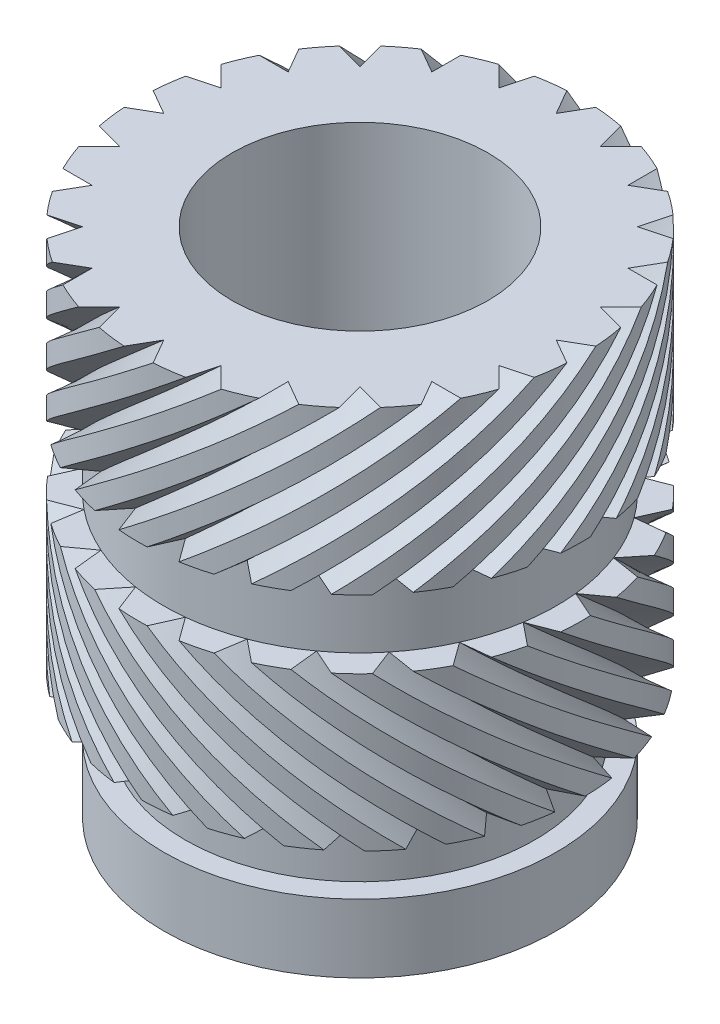
from build123d import *

# Parameters (mm, degrees)
CUT_SWEEP1_PITCH            = 12.666666667
CUT_SWEEP1_HEIGHT           = 1.9
CUT_SWEEP1_RADIUS           = 2.3
CUT_SWEEP1_START_ANGLE      = 180
CIRPATTERN1_COUNT           = 24
MIRROR1_COPY_1_PITCH        = 12.666666667
MIRROR1_COPY_1_HEIGHT       = 1.9
MIRROR1_COPY_1_RADIUS       = 2.3
MIRROR1_COPY_1_START_ANGLE  = -15
MIRROR1_COPY_2_PITCH        = 12.666666667
MIRROR1_COPY_2_HEIGHT       = 1.9
MIRROR1_COPY_2_RADIUS       = 2.3
MIRROR1_COPY_2_START_ANGLE  = -30
MIRROR1_COPY_3_PITCH        = 12.666666667
MIRROR1_COPY_3_HEIGHT       = 1.9
MIRROR1_COPY_3_RADIUS       = 2.3
MIRROR1_COPY_3_START_ANGLE  = -45
MIRROR1_COPY_4_PITCH        = 12.666666667
MIRROR1_COPY_4_HEIGHT       = 1.9
MIRROR1_COPY_4_RADIUS       = 2.3
MIRROR1_COPY_4_START_ANGLE  = -60
MIRROR1_COPY_5_PITCH        = 12.666666667
MIRROR1_COPY_5_HEIGHT       = 1.9
MIRROR1_COPY_5_RADIUS       = 2.3
MIRROR1_COPY_5_START_ANGLE  = -75
MIRROR1_COPY_6_PITCH        = 12.666666667
MIRROR1_COPY_6_HEIGHT       = 1.9
MIRROR1_COPY_6_RADIUS       = 2.3
MIRROR1_COPY_6_START_ANGLE  = -90
MIRROR1_COPY_7_PITCH        = 12.666666667
MIRROR1_COPY_7_HEIGHT       = 1.9
MIRROR1_COPY_7_RADIUS       = 2.3
MIRROR1_COPY_7_START_ANGLE  = -105
MIRROR1_COPY_8_PITCH        = 12.666666667
MIRROR1_COPY_8_HEIGHT       = 1.9
MIRROR1_COPY_8_RADIUS       = 2.3
MIRROR1_COPY_8_START_ANGLE  = -120
MIRROR1_COPY_9_PITCH        = 12.666666667
MIRROR1_COPY_9_HEIGHT       = 1.9
MIRROR1_COPY_9_RADIUS       = 2.3
MIRROR1_COPY_9_START_ANGLE  = -135
MIRROR1_COPY_10_PITCH       = 12.666666667
MIRROR1_COPY_10_HEIGHT      = 1.9
MIRROR1_COPY_10_RADIUS      = 2.3
MIRROR1_COPY_10_START_ANGLE = -150
MIRROR1_COPY_11_PITCH       = 12.666666667
MIRROR1_COPY_11_HEIGHT      = 1.9
MIRROR1_COPY_11_RADIUS      = 2.3
MIRROR1_COPY_11_START_ANGLE = -165
MIRROR1_COPY_12_PITCH       = 12.666666667
MIRROR1_COPY_12_HEIGHT      = 1.9
MIRROR1_COPY_12_RADIUS      = 2.3
MIRROR1_COPY_12_START_ANGLE = -180
MIRROR1_COPY_13_PITCH       = 12.666666667
MIRROR1_COPY_13_HEIGHT      = 1.9
MIRROR1_COPY_13_RADIUS      = 2.3
MIRROR1_COPY_13_START_ANGLE = 165
MIRROR1_COPY_14_PITCH       = 12.666666667
MIRROR1_COPY_14_HEIGHT      = 1.9
MIRROR1_COPY_14_RADIUS      = 2.3
MIRROR1_COPY_14_START_ANGLE = 150
MIRROR1_COPY_15_PITCH       = 12.666666667
MIRROR1_COPY_15_HEIGHT      = 1.9
MIRROR1_COPY_15_RADIUS      = 2.3
MIRROR1_COPY_15_START_ANGLE = 135
MIRROR1_COPY_16_PITCH       = 12.666666667
MIRROR1_COPY_16_HEIGHT      = 1.9
MIRROR1_COPY_16_RADIUS      = 2.3
MIRROR1_COPY_16_START_ANGLE = 120
MIRROR1_COPY_17_PITCH       = 12.666666667
MIRROR1_COPY_17_HEIGHT      = 1.9
MIRROR1_COPY_17_RADIUS      = 2.3
MIRROR1_COPY_17_START_ANGLE = 105
MIRROR1_COPY_18_PITCH       = 12.666666667
MIRROR1_COPY_18_HEIGHT      = 1.9
MIRROR1_COPY_18_RADIUS      = 2.3
MIRROR1_COPY_18_START_ANGLE = 90
MIRROR1_COPY_19_PITCH       = 12.666666667
MIRROR1_COPY_19_HEIGHT      = 1.9
MIRROR1_COPY_19_RADIUS      = 2.3
MIRROR1_COPY_19_START_ANGLE = 75
MIRROR1_COPY_20_PITCH       = 12.666666667
MIRROR1_COPY_20_HEIGHT      = 1.9
MIRROR1_COPY_20_RADIUS      = 2.3
MIRROR1_COPY_20_START_ANGLE = 60
MIRROR1_COPY_21_PITCH       = 12.666666667
MIRROR1_COPY_21_HEIGHT      = 1.9
MIRROR1_COPY_21_RADIUS      = 2.3
MIRROR1_COPY_21_START_ANGLE = 45
MIRROR1_COPY_22_PITCH       = 12.666666667
MIRROR1_COPY_22_HEIGHT      = 1.9
MIRROR1_COPY_22_RADIUS      = 2.3
MIRROR1_COPY_22_START_ANGLE = 30
MIRROR1_COPY_23_PITCH       = 12.666666667
MIRROR1_COPY_23_HEIGHT      = 1.9
MIRROR1_COPY_23_RADIUS      = 2.3
MIRROR1_COPY_23_START_ANGLE = 15
MIRROR1_COPY_24_PITCH       = 12.666666667
MIRROR1_COPY_24_HEIGHT      = 1.9
MIRROR1_COPY_24_RADIUS      = 2.3


with BuildPart() as part:
    # Sketch1 → Revolve1 (revolve)
    with BuildSketch(Plane.XY):
        Polygon((1.5, 6), (1.5, 0), (2.3, 0), (2.3, 0.8), (2.05, 0.8), (2.05, 1.5), (2.6, 1.5), (2.6, 3.3), (2.3, 3.3), (2.3, 4.1), (2.6, 4.1), (2.6, 6), align=None)
    revolve(axis=Axis((0, 0, 0), (0, 1, 0)))

    # Cut-Sweep1: sweep along a helix
    with BuildLine() as cut_sweep1_path:
        add(Helix(CUT_SWEEP1_PITCH, CUT_SWEEP1_HEIGHT, CUT_SWEEP1_RADIUS, center=(0, 6, 0), direction=(0, -1, 0), mode=Mode.PRIVATE).rotate(Axis((0, 6, 0), (0, -1, 0)), CUT_SWEEP1_START_ANGLE))
    # Sketch3 → Cut-Sweep1 (sweep, cut)
    with BuildSketch(Plane(origin=(0, 6, 0), x_dir=(1, 0, 0), z_dir=(0, 1, 0))):
        Polygon((-2.819615242, 0), (-2.819615242, 0.3), (-2.3, 0), (-2.819615242, -0.3), align=None)
    cut_sweep1 = sweep(path=cut_sweep1_path.line, is_frenet=True, mode=Mode.SUBTRACT)

    # CirPattern1: Cut-Sweep1 ×24 about axis
    cirpattern1_axis = Axis((0, 0, 0), (0, -1, 0))
    for i in range(1, CIRPATTERN1_COUNT):
        add(cut_sweep1.rotate(cirpattern1_axis, i * 360 / CIRPATTERN1_COUNT), mode=Mode.SUBTRACT)

    # Mirror1 copy 1: sweep along a helix
    with BuildLine() as mirror1_copy_1_path:
        add(Helix(MIRROR1_COPY_1_PITCH, MIRROR1_COPY_1_HEIGHT, MIRROR1_COPY_1_RADIUS, center=(0, 1.4, 0), direction=(0, 1, 0), lefthand=True, mode=Mode.PRIVATE).rotate(Axis((0, 1.4, 0), (0, 1, 0)), MIRROR1_COPY_1_START_ANGLE))
    # Mirror1 copy 1 sketch → Mirror1 copy 1 (sweep, cut)
    with BuildSketch(Plane(origin=(0, 1.4, 0), x_dir=(0.9659258262890683, 0, 0.25881904510252074), z_dir=(0, -1, 0))):
        Polygon((-2.819615242, 0), (-2.819615242, -0.3), (-2.3, 0), (-2.819615242, 0.3), align=None)
    sweep(path=mirror1_copy_1_path.line, is_frenet=True, mode=Mode.SUBTRACT)

    # Mirror1 copy 2: sweep along a helix
    with BuildLine() as mirror1_copy_2_path:
        add(Helix(MIRROR1_COPY_2_PITCH, MIRROR1_COPY_2_HEIGHT, MIRROR1_COPY_2_RADIUS, center=(0, 1.4, 0), direction=(0, 1, 0), lefthand=True, mode=Mode.PRIVATE).rotate(Axis((0, 1.4, 0), (0, 1, 0)), MIRROR1_COPY_2_START_ANGLE))
    # Mirror1 copy 2 sketch → Mirror1 copy 2 (sweep, cut)
    with BuildSketch(Plane(origin=(0, 1.4, 0), x_dir=(0.8660254037844387, 0, 0.49999999999999994), z_dir=(0, -1, 0))):
        Polygon((-2.819615242, 0), (-2.819615242, -0.3), (-2.3, 0), (-2.819615242, 0.3), align=None)
    sweep(path=mirror1_copy_2_path.line, is_frenet=True, mode=Mode.SUBTRACT)

    # Mirror1 copy 3: sweep along a helix
    with BuildLine() as mirror1_copy_3_path:
        add(Helix(MIRROR1_COPY_3_PITCH, MIRROR1_COPY_3_HEIGHT, MIRROR1_COPY_3_RADIUS, center=(0, 1.4, 0), direction=(0, 1, 0), lefthand=True, mode=Mode.PRIVATE).rotate(Axis((0, 1.4, 0), (0, 1, 0)), MIRROR1_COPY_3_START_ANGLE))
    # Mirror1 copy 3 sketch → Mirror1 copy 3 (sweep, cut)
    with BuildSketch(Plane(origin=(0, 1.4, 0), x_dir=(0.7071067811865476, 0, 0.7071067811865475), z_dir=(0, -1, 0))):
        Polygon((-2.819615242, 0), (-2.819615242, -0.3), (-2.3, 0), (-2.819615242, 0.3), align=None)
    sweep(path=mirror1_copy_3_path.line, is_frenet=True, mode=Mode.SUBTRACT)

    # Mirror1 copy 4: sweep along a helix
    with BuildLine() as mirror1_copy_4_path:
        add(Helix(MIRROR1_COPY_4_PITCH, MIRROR1_COPY_4_HEIGHT, MIRROR1_COPY_4_RADIUS, center=(0, 1.4, 0), direction=(0, 1, 0), lefthand=True, mode=Mode.PRIVATE).rotate(Axis((0, 1.4, 0), (0, 1, 0)), MIRROR1_COPY_4_START_ANGLE))
    # Mirror1 copy 4 sketch → Mirror1 copy 4 (sweep, cut)
    with BuildSketch(Plane(origin=(0, 1.4, 0), x_dir=(0.5000000000000001, 0, 0.8660254037844386), z_dir=(0, -1, 0))):
        Polygon((-2.819615242, 0), (-2.819615242, -0.3), (-2.3, 0), (-2.819615242, 0.3), align=None)
    sweep(path=mirror1_copy_4_path.line, is_frenet=True, mode=Mode.SUBTRACT)

    # Mirror1 copy 5: sweep along a helix
    with BuildLine() as mirror1_copy_5_path:
        add(Helix(MIRROR1_COPY_5_PITCH, MIRROR1_COPY_5_HEIGHT, MIRROR1_COPY_5_RADIUS, center=(0, 1.4, 0), direction=(0, 1, 0), lefthand=True, mode=Mode.PRIVATE).rotate(Axis((0, 1.4, 0), (0, 1, 0)), MIRROR1_COPY_5_START_ANGLE))
    # Mirror1 copy 5 sketch → Mirror1 copy 5 (sweep, cut)
    with BuildSketch(Plane(origin=(0, 1.4, 0), x_dir=(0.25881904510252074, 0, 0.9659258262890683), z_dir=(0, -1, 0))):
        Polygon((-2.819615242, 0), (-2.819615242, -0.3), (-2.3, 0), (-2.819615242, 0.3), align=None)
    sweep(path=mirror1_copy_5_path.line, is_frenet=True, mode=Mode.SUBTRACT)

    # Mirror1 copy 6: sweep along a helix
    with BuildLine() as mirror1_copy_6_path:
        add(Helix(MIRROR1_COPY_6_PITCH, MIRROR1_COPY_6_HEIGHT, MIRROR1_COPY_6_RADIUS, center=(0, 1.4, 0), direction=(0, 1, 0), lefthand=True, mode=Mode.PRIVATE).rotate(Axis((0, 1.4, 0), (0, 1, 0)), MIRROR1_COPY_6_START_ANGLE))
    # Mirror1 copy 6 sketch → Mirror1 copy 6 (sweep, cut)
    with BuildSketch(Plane(origin=(0, 1.4, 0), x_dir=(0, 0, 1), z_dir=(0, -1, 0))):
        Polygon((-2.819615242, 0), (-2.819615242, -0.3), (-2.3, 0), (-2.819615242, 0.3), align=None)
    sweep(path=mirror1_copy_6_path.line, is_frenet=True, mode=Mode.SUBTRACT)

    # Mirror1 copy 7: sweep along a helix
    with BuildLine() as mirror1_copy_7_path:
        add(Helix(MIRROR1_COPY_7_PITCH, MIRROR1_COPY_7_HEIGHT, MIRROR1_COPY_7_RADIUS, center=(0, 1.4, 0), direction=(0, 1, 0), lefthand=True, mode=Mode.PRIVATE).rotate(Axis((0, 1.4, 0), (0, 1, 0)), MIRROR1_COPY_7_START_ANGLE))
    # Mirror1 copy 7 sketch → Mirror1 copy 7 (sweep, cut)
    with BuildSketch(Plane(origin=(0, 1.4, 0), x_dir=(-0.25881904510252085, 0, 0.9659258262890683), z_dir=(0, -1, 0))):
        Polygon((-2.819615242, 0), (-2.819615242, -0.3), (-2.3, 0), (-2.819615242, 0.3), align=None)
    sweep(path=mirror1_copy_7_path.line, is_frenet=True, mode=Mode.SUBTRACT)

    # Mirror1 copy 8: sweep along a helix
    with BuildLine() as mirror1_copy_8_path:
        add(Helix(MIRROR1_COPY_8_PITCH, MIRROR1_COPY_8_HEIGHT, MIRROR1_COPY_8_RADIUS, center=(0, 1.4, 0), direction=(0, 1, 0), lefthand=True, mode=Mode.PRIVATE).rotate(Axis((0, 1.4, 0), (0, 1, 0)), MIRROR1_COPY_8_START_ANGLE))
    # Mirror1 copy 8 sketch → Mirror1 copy 8 (sweep, cut)
    with BuildSketch(Plane(origin=(0, 1.4, 0), x_dir=(-0.4999999999999998, 0, 0.8660254037844387), z_dir=(0, -1, 0))):
        Polygon((-2.819615242, 0), (-2.819615242, -0.3), (-2.3, 0), (-2.819615242, 0.3), align=None)
    sweep(path=mirror1_copy_8_path.line, is_frenet=True, mode=Mode.SUBTRACT)

    # Mirror1 copy 9: sweep along a helix
    with BuildLine() as mirror1_copy_9_path:
        add(Helix(MIRROR1_COPY_9_PITCH, MIRROR1_COPY_9_HEIGHT, MIRROR1_COPY_9_RADIUS, center=(0, 1.4, 0), direction=(0, 1, 0), lefthand=True, mode=Mode.PRIVATE).rotate(Axis((0, 1.4, 0), (0, 1, 0)), MIRROR1_COPY_9_START_ANGLE))
    # Mirror1 copy 9 sketch → Mirror1 copy 9 (sweep, cut)
    with BuildSketch(Plane(origin=(0, 1.4, 0), x_dir=(-0.7071067811865475, 0, 0.7071067811865476), z_dir=(0, -1, 0))):
        Polygon((-2.819615242, 0), (-2.819615242, -0.3), (-2.3, 0), (-2.819615242, 0.3), align=None)
    sweep(path=mirror1_copy_9_path.line, is_frenet=True, mode=Mode.SUBTRACT)

    # Mirror1 copy 10: sweep along a helix
    with BuildLine() as mirror1_copy_10_path:
        add(Helix(MIRROR1_COPY_10_PITCH, MIRROR1_COPY_10_HEIGHT, MIRROR1_COPY_10_RADIUS, center=(0, 1.4, 0), direction=(0, 1, 0), lefthand=True, mode=Mode.PRIVATE).rotate(Axis((0, 1.4, 0), (0, 1, 0)), MIRROR1_COPY_10_START_ANGLE))
    # Mirror1 copy 10 sketch → Mirror1 copy 10 (sweep, cut)
    with BuildSketch(Plane(origin=(0, 1.4, 0), x_dir=(-0.8660254037844387, 0, 0.49999999999999994), z_dir=(0, -1, 0))):
        Polygon((-2.819615242, 0), (-2.819615242, -0.3), (-2.3, 0), (-2.819615242, 0.3), align=None)
    sweep(path=mirror1_copy_10_path.line, is_frenet=True, mode=Mode.SUBTRACT)

    # Mirror1 copy 11: sweep along a helix
    with BuildLine() as mirror1_copy_11_path:
        add(Helix(MIRROR1_COPY_11_PITCH, MIRROR1_COPY_11_HEIGHT, MIRROR1_COPY_11_RADIUS, center=(0, 1.4, 0), direction=(0, 1, 0), lefthand=True, mode=Mode.PRIVATE).rotate(Axis((0, 1.4, 0), (0, 1, 0)), MIRROR1_COPY_11_START_ANGLE))
    # Mirror1 copy 11 sketch → Mirror1 copy 11 (sweep, cut)
    with BuildSketch(Plane(origin=(0, 1.4, 0), x_dir=(-0.9659258262890682, 0, 0.258819045102521), z_dir=(0, -1, 0))):
        Polygon((-2.819615242, 0), (-2.819615242, -0.3), (-2.3, 0), (-2.819615242, 0.3), align=None)
    sweep(path=mirror1_copy_11_path.line, is_frenet=True, mode=Mode.SUBTRACT)

    # Mirror1 copy 12: sweep along a helix
    with BuildLine() as mirror1_copy_12_path:
        add(Helix(MIRROR1_COPY_12_PITCH, MIRROR1_COPY_12_HEIGHT, MIRROR1_COPY_12_RADIUS, center=(0, 1.4, 0), direction=(0, 1, 0), lefthand=True, mode=Mode.PRIVATE).rotate(Axis((0, 1.4, 0), (0, 1, 0)), MIRROR1_COPY_12_START_ANGLE))
    # Mirror1 copy 12 sketch → Mirror1 copy 12 (sweep, cut)
    with BuildSketch(Plane(origin=(0, 1.4, 0), x_dir=(-1, 0, 0), z_dir=(0, -1, 0))):
        Polygon((-2.819615242, 0), (-2.819615242, -0.3), (-2.3, 0), (-2.819615242, 0.3), align=None)
    sweep(path=mirror1_copy_12_path.line, is_frenet=True, mode=Mode.SUBTRACT)

    # Mirror1 copy 13: sweep along a helix
    with BuildLine() as mirror1_copy_13_path:
        add(Helix(MIRROR1_COPY_13_PITCH, MIRROR1_COPY_13_HEIGHT, MIRROR1_COPY_13_RADIUS, center=(0, 1.4, 0), direction=(0, 1, 0), lefthand=True, mode=Mode.PRIVATE).rotate(Axis((0, 1.4, 0), (0, 1, 0)), MIRROR1_COPY_13_START_ANGLE))
    # Mirror1 copy 13 sketch → Mirror1 copy 13 (sweep, cut)
    with BuildSketch(Plane(origin=(0, 1.4, 0), x_dir=(-0.9659258262890683, 0, -0.2588190451025208), z_dir=(0, -1, 0))):
        Polygon((-2.819615242, 0), (-2.819615242, -0.3), (-2.3, 0), (-2.819615242, 0.3), align=None)
    sweep(path=mirror1_copy_13_path.line, is_frenet=True, mode=Mode.SUBTRACT)

    # Mirror1 copy 14: sweep along a helix
    with BuildLine() as mirror1_copy_14_path:
        add(Helix(MIRROR1_COPY_14_PITCH, MIRROR1_COPY_14_HEIGHT, MIRROR1_COPY_14_RADIUS, center=(0, 1.4, 0), direction=(0, 1, 0), lefthand=True, mode=Mode.PRIVATE).rotate(Axis((0, 1.4, 0), (0, 1, 0)), MIRROR1_COPY_14_START_ANGLE))
    # Mirror1 copy 14 sketch → Mirror1 copy 14 (sweep, cut)
    with BuildSketch(Plane(origin=(0, 1.4, 0), x_dir=(-0.8660254037844386, 0, -0.5000000000000001), z_dir=(0, -1, 0))):
        Polygon((-2.819615242, 0), (-2.819615242, -0.3), (-2.3, 0), (-2.819615242, 0.3), align=None)
    sweep(path=mirror1_copy_14_path.line, is_frenet=True, mode=Mode.SUBTRACT)

    # Mirror1 copy 15: sweep along a helix
    with BuildLine() as mirror1_copy_15_path:
        add(Helix(MIRROR1_COPY_15_PITCH, MIRROR1_COPY_15_HEIGHT, MIRROR1_COPY_15_RADIUS, center=(0, 1.4, 0), direction=(0, 1, 0), lefthand=True, mode=Mode.PRIVATE).rotate(Axis((0, 1.4, 0), (0, 1, 0)), MIRROR1_COPY_15_START_ANGLE))
    # Mirror1 copy 15 sketch → Mirror1 copy 15 (sweep, cut)
    with BuildSketch(Plane(origin=(0, 1.4, 0), x_dir=(-0.7071067811865477, 0, -0.7071067811865475), z_dir=(0, -1, 0))):
        Polygon((-2.819615242, 0), (-2.819615242, -0.3), (-2.3, 0), (-2.819615242, 0.3), align=None)
    sweep(path=mirror1_copy_15_path.line, is_frenet=True, mode=Mode.SUBTRACT)

    # Mirror1 copy 16: sweep along a helix
    with BuildLine() as mirror1_copy_16_path:
        add(Helix(MIRROR1_COPY_16_PITCH, MIRROR1_COPY_16_HEIGHT, MIRROR1_COPY_16_RADIUS, center=(0, 1.4, 0), direction=(0, 1, 0), lefthand=True, mode=Mode.PRIVATE).rotate(Axis((0, 1.4, 0), (0, 1, 0)), MIRROR1_COPY_16_START_ANGLE))
    # Mirror1 copy 16 sketch → Mirror1 copy 16 (sweep, cut)
    with BuildSketch(Plane(origin=(0, 1.4, 0), x_dir=(-0.5000000000000004, 0, -0.8660254037844384), z_dir=(0, -1, 0))):
        Polygon((-2.819615242, 0), (-2.819615242, -0.3), (-2.3, 0), (-2.819615242, 0.3), align=None)
    sweep(path=mirror1_copy_16_path.line, is_frenet=True, mode=Mode.SUBTRACT)

    # Mirror1 copy 17: sweep along a helix
    with BuildLine() as mirror1_copy_17_path:
        add(Helix(MIRROR1_COPY_17_PITCH, MIRROR1_COPY_17_HEIGHT, MIRROR1_COPY_17_RADIUS, center=(0, 1.4, 0), direction=(0, 1, 0), lefthand=True, mode=Mode.PRIVATE).rotate(Axis((0, 1.4, 0), (0, 1, 0)), MIRROR1_COPY_17_START_ANGLE))
    # Mirror1 copy 17 sketch → Mirror1 copy 17 (sweep, cut)
    with BuildSketch(Plane(origin=(0, 1.4, 0), x_dir=(-0.25881904510252063, 0, -0.9659258262890683), z_dir=(0, -1, 0))):
        Polygon((-2.819615242, 0), (-2.819615242, -0.3), (-2.3, 0), (-2.819615242, 0.3), align=None)
    sweep(path=mirror1_copy_17_path.line, is_frenet=True, mode=Mode.SUBTRACT)

    # Mirror1 copy 18: sweep along a helix
    with BuildLine() as mirror1_copy_18_path:
        add(Helix(MIRROR1_COPY_18_PITCH, MIRROR1_COPY_18_HEIGHT, MIRROR1_COPY_18_RADIUS, center=(0, 1.4, 0), direction=(0, 1, 0), lefthand=True, mode=Mode.PRIVATE).rotate(Axis((0, 1.4, 0), (0, 1, 0)), MIRROR1_COPY_18_START_ANGLE))
    # Mirror1 copy 18 sketch → Mirror1 copy 18 (sweep, cut)
    with BuildSketch(Plane(origin=(0, 1.4, 0), x_dir=(0, 0, -1), z_dir=(0, -1, 0))):
        Polygon((-2.819615242, 0), (-2.819615242, -0.3), (-2.3, 0), (-2.819615242, 0.3), align=None)
    sweep(path=mirror1_copy_18_path.line, is_frenet=True, mode=Mode.SUBTRACT)

    # Mirror1 copy 19: sweep along a helix
    with BuildLine() as mirror1_copy_19_path:
        add(Helix(MIRROR1_COPY_19_PITCH, MIRROR1_COPY_19_HEIGHT, MIRROR1_COPY_19_RADIUS, center=(0, 1.4, 0), direction=(0, 1, 0), lefthand=True, mode=Mode.PRIVATE).rotate(Axis((0, 1.4, 0), (0, 1, 0)), MIRROR1_COPY_19_START_ANGLE))
    # Mirror1 copy 19 sketch → Mirror1 copy 19 (sweep, cut)
    with BuildSketch(Plane(origin=(0, 1.4, 0), x_dir=(0.2588190451025203, 0, -0.9659258262890684), z_dir=(0, -1, 0))):
        Polygon((-2.819615242, 0), (-2.819615242, -0.3), (-2.3, 0), (-2.819615242, 0.3), align=None)
    sweep(path=mirror1_copy_19_path.line, is_frenet=True, mode=Mode.SUBTRACT)

    # Mirror1 copy 20: sweep along a helix
    with BuildLine() as mirror1_copy_20_path:
        add(Helix(MIRROR1_COPY_20_PITCH, MIRROR1_COPY_20_HEIGHT, MIRROR1_COPY_20_RADIUS, center=(0, 1.4, 0), direction=(0, 1, 0), lefthand=True, mode=Mode.PRIVATE).rotate(Axis((0, 1.4, 0), (0, 1, 0)), MIRROR1_COPY_20_START_ANGLE))
    # Mirror1 copy 20 sketch → Mirror1 copy 20 (sweep, cut)
    with BuildSketch(Plane(origin=(0, 1.4, 0), x_dir=(0.5000000000000001, 0, -0.8660254037844386), z_dir=(0, -1, 0))):
        Polygon((-2.819615242, 0), (-2.819615242, -0.3), (-2.3, 0), (-2.819615242, 0.3), align=None)
    sweep(path=mirror1_copy_20_path.line, is_frenet=True, mode=Mode.SUBTRACT)

    # Mirror1 copy 21: sweep along a helix
    with BuildLine() as mirror1_copy_21_path:
        add(Helix(MIRROR1_COPY_21_PITCH, MIRROR1_COPY_21_HEIGHT, MIRROR1_COPY_21_RADIUS, center=(0, 1.4, 0), direction=(0, 1, 0), lefthand=True, mode=Mode.PRIVATE).rotate(Axis((0, 1.4, 0), (0, 1, 0)), MIRROR1_COPY_21_START_ANGLE))
    # Mirror1 copy 21 sketch → Mirror1 copy 21 (sweep, cut)
    with BuildSketch(Plane(origin=(0, 1.4, 0), x_dir=(0.7071067811865474, 0, -0.7071067811865477), z_dir=(0, -1, 0))):
        Polygon((-2.819615242, 0), (-2.819615242, -0.3), (-2.3, 0), (-2.819615242, 0.3), align=None)
    sweep(path=mirror1_copy_21_path.line, is_frenet=True, mode=Mode.SUBTRACT)

    # Mirror1 copy 22: sweep along a helix
    with BuildLine() as mirror1_copy_22_path:
        add(Helix(MIRROR1_COPY_22_PITCH, MIRROR1_COPY_22_HEIGHT, MIRROR1_COPY_22_RADIUS, center=(0, 1.4, 0), direction=(0, 1, 0), lefthand=True, mode=Mode.PRIVATE).rotate(Axis((0, 1.4, 0), (0, 1, 0)), MIRROR1_COPY_22_START_ANGLE))
    # Mirror1 copy 22 sketch → Mirror1 copy 22 (sweep, cut)
    with BuildSketch(Plane(origin=(0, 1.4, 0), x_dir=(0.8660254037844384, 0, -0.5000000000000004), z_dir=(0, -1, 0))):
        Polygon((-2.819615242, 0), (-2.819615242, -0.3), (-2.3, 0), (-2.819615242, 0.3), align=None)
    sweep(path=mirror1_copy_22_path.line, is_frenet=True, mode=Mode.SUBTRACT)

    # Mirror1 copy 23: sweep along a helix
    with BuildLine() as mirror1_copy_23_path:
        add(Helix(MIRROR1_COPY_23_PITCH, MIRROR1_COPY_23_HEIGHT, MIRROR1_COPY_23_RADIUS, center=(0, 1.4, 0), direction=(0, 1, 0), lefthand=True, mode=Mode.PRIVATE).rotate(Axis((0, 1.4, 0), (0, 1, 0)), MIRROR1_COPY_23_START_ANGLE))
    # Mirror1 copy 23 sketch → Mirror1 copy 23 (sweep, cut)
    with BuildSketch(Plane(origin=(0, 1.4, 0), x_dir=(0.9659258262890683, 0, -0.2588190451025207), z_dir=(0, -1, 0))):
        Polygon((-2.819615242, 0), (-2.819615242, -0.3), (-2.3, 0), (-2.819615242, 0.3), align=None)
    sweep(path=mirror1_copy_23_path.line, is_frenet=True, mode=Mode.SUBTRACT)

    # Mirror1 copy 24: sweep along a helix
    with BuildLine() as mirror1_copy_24_path:
        Helix(MIRROR1_COPY_24_PITCH, MIRROR1_COPY_24_HEIGHT, MIRROR1_COPY_24_RADIUS, center=(0, 1.4, 0), direction=(0, 1, 0), lefthand=True)
    # Mirror1 copy 24 sketch → Mirror1 copy 24 (sweep, cut)
    with BuildSketch(Plane.XZ.offset(-1.4)):
        Polygon((-2.819615242, 0), (-2.819615242, -0.3), (-2.3, 0), (-2.819615242, 0.3), align=None)
    sweep(path=mirror1_copy_24_path.line, is_frenet=True, mode=Mode.SUBTRACT)


solid = part.part
